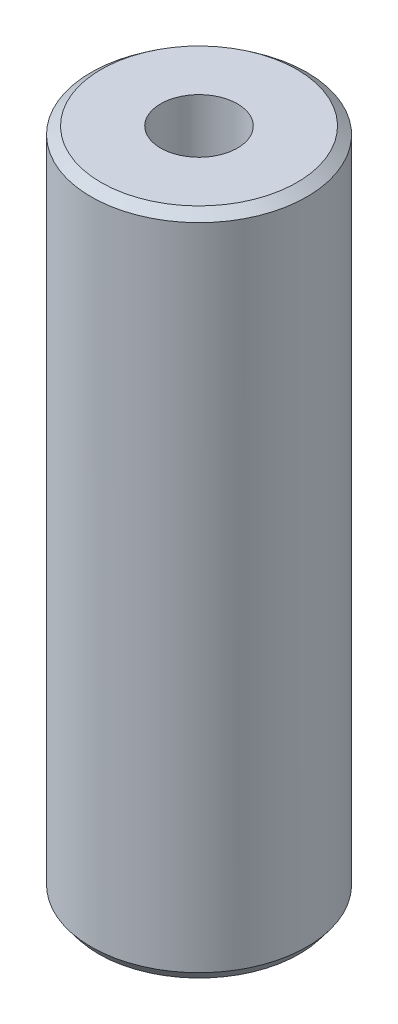
from build123d import *
from OCP.BRepFilletAPI import BRepFilletAPI_MakeChamfer

# Parameters (mm, degrees)
SKETCH1_R           = 20
BOSS_EXTRUDE1_DEPTH = 123.657801221
SKETCH2_R           = 7.121071677
CUT_EXTRUDE1_DEPTH  = 127.851297994
CHAMFER1_SIZE       = 1.388625498
CHAMFER1_SIZE2      = 1.838327515


with BuildPart() as part:
    # Sketch1 → Boss-Extrude1 (new body)
    with BuildSketch(Plane(origin=(0, 0, 0), x_dir=(1, 0, 0), z_dir=(0, 1, 0))):
        Circle(SKETCH1_R)
    extrude(amount=BOSS_EXTRUDE1_DEPTH)

    # Sketch2 → Cut-Extrude1 (cut, through all)
    with BuildSketch(Plane(origin=(0, 0, 0), x_dir=(1, 0, 0), z_dir=(0, 1, 0))):
        Circle(SKETCH2_R)
    extrude(amount=CUT_EXTRUDE1_DEPTH, mode=Mode.SUBTRACT)

    # Chamfer1: one chamfer whose edges measure the first distance from different faces: ONE call of the kernel's chamfer builder (chamfer() names one face for all edges)
    chamfer1_edges_1 = [part.edges().sort_by_distance(p)[0] for p in [
        (-20, 123.657801221, 0),
    ]]
    chamfer1_side_1 = [part.faces().sort_by_distance(p)[0] for p in [
        (-20, 61.82890061, 0),
    ]]
    chamfer1_edges_2 = [part.edges().sort_by_distance(p)[0] for p in [
        (-20, 0, 0),
    ]]
    chamfer1_side_2 = [part.faces().sort_by_distance(p)[0] for p in [
        (-19.434314575, 0, 0),
    ]]
    chamfer1 = BRepFilletAPI_MakeChamfer(part.part.solid().wrapped)
    for e in chamfer1_edges_1:
        chamfer1.Add(CHAMFER1_SIZE, CHAMFER1_SIZE2, e.wrapped, chamfer1_side_1[0].wrapped)  # the first distance lies on this face
    for e in chamfer1_edges_2:
        chamfer1.Add(CHAMFER1_SIZE, CHAMFER1_SIZE2, e.wrapped, chamfer1_side_2[0].wrapped)  # the first distance lies on this face
    add(Compound.cast(chamfer1.Shape()), mode=Mode.REPLACE)


solid = part.part
